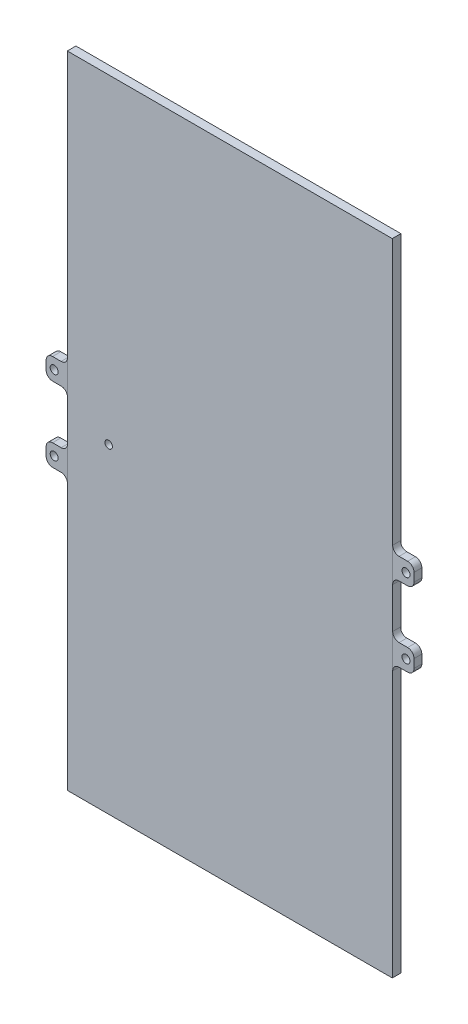
from build123d import *

# Parameters (mm, degrees)
SKETCH1_W               = 120
SKETCH1_H               = 60.9
BOSS_EXTRUDE1_DEPTH     = 1.61
CUT_EXTRUDE1_DEPTH      = 0.5
SKETCH3_W               = 4
SKETCH3_H               = 1.54
BOSS_EXTRUDE2_DEPTH     = 4
SKETCH5_W               = 4
SKETCH5_H               = 1.47
BOSS_EXTRUDE3_DEPTH     = 4
CUT_EXTRUDE3_DEPTH      = 70.203858996
CUT_EXTRUDE3_DEPTH_BACK = 70.203858996
SKETCH7_R               = 0.75
FILLET1_R               = 1.2
FILLET2_R               = 1.2
SKETCH8_R               = 0.7
CUT_EXTRUDE4_DEPTH      = 70.205452097


with BuildPart() as part:
    # Sketch1 → Boss-Extrude1 (new body)
    with BuildSketch(Plane(origin=(0, 0, 0), x_dir=(0, 1, 0), z_dir=(0, 0, 1))):
        Rectangle(SKETCH1_W, SKETCH1_H)
    extrude(amount=BOSS_EXTRUDE1_DEPTH)

    # Sketch2 → Cut-Extrude1 (cut)
    with BuildSketch(Plane(origin=(0, 0, 0), x_dir=(1, 0, 0), z_dir=(0, 0, -1))):
        Polygon((28.481704711, 0), (17.415141609, 6.389283186), (17.415141609, -6.389283186), align=None)
    extrude(amount=-CUT_EXTRUDE1_DEPTH, mode=Mode.SUBTRACT)

    # Sketch3 → Boss-Extrude2 (add)
    with BuildSketch(Plane(origin=(-30.45, 0, 0), x_dir=(0, -1, 0), z_dir=(-1, 0, 0))):
        with Locations((-7, 0.805)):
            Rectangle(SKETCH3_W, SKETCH3_H)
        with Locations((7, 0.805)):
            Rectangle(SKETCH3_W, SKETCH3_H)
    extrude(amount=BOSS_EXTRUDE2_DEPTH)

    # Sketch5 → Boss-Extrude3 (add)
    with BuildSketch(Plane.YZ.offset(30.45)):
        with Locations((7, 0.805)):
            Rectangle(SKETCH5_W, SKETCH5_H)
        with Locations((-7, 0.805)):
            Rectangle(SKETCH5_W, SKETCH5_H)
    extrude(amount=BOSS_EXTRUDE3_DEPTH)

    # Sketch7 → Cut-Extrude3 (cut, two sides: drawn at the far end of the back side and taken through both)
    with BuildSketch(Plane.XY.offset(1.54).offset(-CUT_EXTRUDE3_DEPTH_BACK)):
        with Locations((32.95, 7)):
            Circle(SKETCH7_R)
        with Locations((32.95, -7)):
            Circle(SKETCH7_R)
        with Locations((-32.95, -7)):
            Circle(SKETCH7_R)
        with Locations((-32.95, 7)):
            Circle(SKETCH7_R)
    extrude(amount=CUT_EXTRUDE3_DEPTH + CUT_EXTRUDE3_DEPTH_BACK, mode=Mode.SUBTRACT)

    # Fillet1
    fillet1_edges = [part.edges().sort_by_distance(p)[0] for p in [
        (30.45, 9, 0.805),
        (30.45, -5, 0.805),
        (30.45, -9, 0.805),
        (30.45, 5, 0.805),
        (-30.45, 9, 0.805),
        (-30.45, 5, 0.805),
        (-30.45, -9, 0.805),
        (-30.45, -5, 0.805),
    ]]
    fillet(fillet1_edges, radius=FILLET1_R)

    # Fillet2
    fillet2_edges = [part.edges().sort_by_distance(p)[0] for p in [
        (-34.45, -9, 0.805),
        (-34.45, -5, 0.805),
        (-34.45, 5, 0.805),
        (-34.45, 9, 0.805),
        (34.45, 9, 0.805),
        (34.45, 5, 0.805),
        (34.45, -9, 0.805),
        (34.45, -5, 0.805),
    ]]
    fillet(fillet2_edges, radius=FILLET2_R)

    # Sketch8 → Cut-Extrude4 (cut, through all)
    with BuildSketch(Plane(origin=(0, 0, 0), x_dir=(1, 0, 0), z_dir=(0, 0, -1))):
        with Locations((-22.7, 0)):
            Circle(SKETCH8_R)
    extrude(amount=-CUT_EXTRUDE4_DEPTH, mode=Mode.SUBTRACT)


solid = part.part
